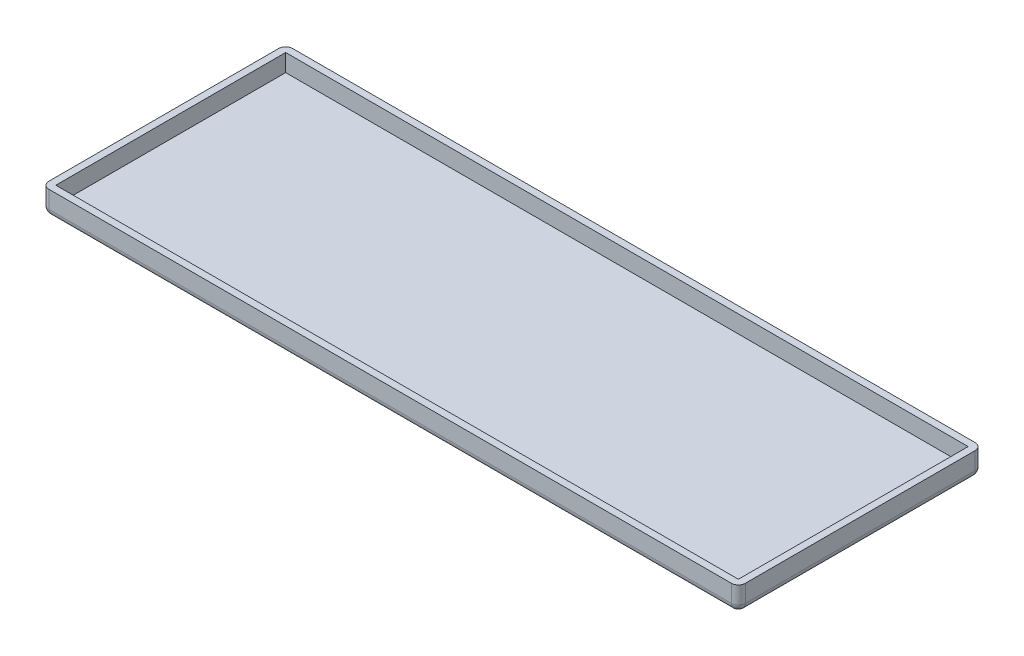
from build123d import *

# Parameters (mm, degrees)
RECTANGLEBOX_DEPTH      = 5
RECTANGLEBOX_DEPTH_BACK = 2
SKETCHREC_W             = 200
SKETCHREC_H             = 70
RECTANGLER_R            = 2
RECTANGLEC_START        = -98
RECTANGLEC_OUTLINE_W    = 5
RECTANGLEC_OUTLINE_H    = 66
RECTANGLEC_DEPTH        = 196


# Read off the part's stored shape, not the designer's step: RectangleC
with BuildPart() as part:
    # SketchRec → RectangleBox (new, two sides: drawn at the far end of the back side and taken through both)
    with BuildSketch(Plane(origin=(0, 0, 0), x_dir=(1, 0, 0), z_dir=(0, 1, 0)).offset(-RECTANGLEBOX_DEPTH_BACK)):
        Rectangle(SKETCHREC_W, SKETCHREC_H)
    extrude(amount=RECTANGLEBOX_DEPTH + RECTANGLEBOX_DEPTH_BACK)

    # RectangleR
    rectangler_edges = [part.edges().sort_by_distance(p)[0] for p in [
        (-100, -2, 0),
        (0, -2, 35),
        (100, -2, 0),
        (0, -2, -35),
        (100, 1.5, 35),
        (-100, 1.5, 35),
        (-100, 1.5, -35),
        (100, 1.5, -35),
    ]]
    fillet(rectangler_edges, radius=RECTANGLER_R)

    # RectangleC outline → RectangleC (cut)
    with BuildSketch(Plane.YZ.offset(RECTANGLEC_START)):
        with Locations((2.5, 0)):
            Rectangle(RECTANGLEC_OUTLINE_W, RECTANGLEC_OUTLINE_H)
    extrude(amount=RECTANGLEC_DEPTH, mode=Mode.SUBTRACT)


solid = part.part
